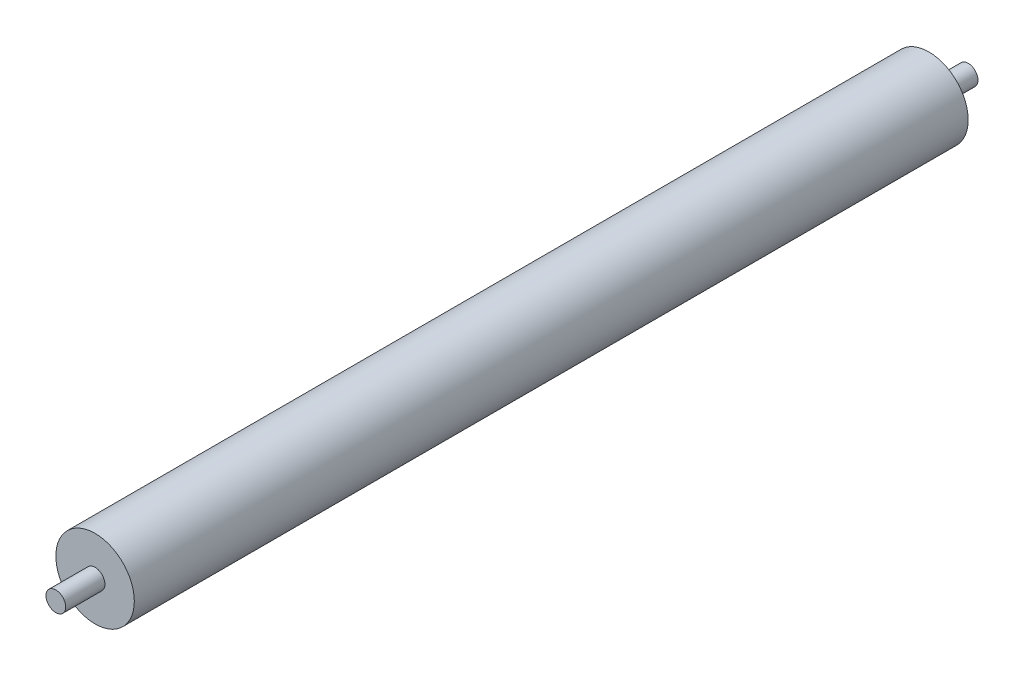
from build123d import *

# Parameters (mm, degrees)
SKETCH1_R           = 25.4
BOSS_EXTRUDE1_DEPTH = 590.55
SKETCH2_OUTSIDE_W   = 171.78
SKETCH2_OUTSIDE_H   = 171.78
SKETCH2_OUTSIDE_R   = 6.361935525
CUT_EXTRUDE1_DEPTH  = 25.4
SKETCH5_OUTSIDE_W   = 171.78
SKETCH5_OUTSIDE_H   = 171.78
SKETCH5_OUTSIDE_R   = 6.377907631
CUT_EXTRUDE4_DEPTH  = 25.4


with BuildPart() as part:
    # Sketch1 → Boss-Extrude1 (new body)
    with BuildSketch(Plane.XY):
        Circle(SKETCH1_R)
    extrude(amount=BOSS_EXTRUDE1_DEPTH)

    # Sketch2 outside → Cut-Extrude1 (cut)
    with BuildSketch(Plane.XY):
        Rectangle(SKETCH2_OUTSIDE_W, SKETCH2_OUTSIDE_H)
        Circle(SKETCH2_OUTSIDE_R, mode=Mode.SUBTRACT)
    extrude(amount=CUT_EXTRUDE1_DEPTH, mode=Mode.SUBTRACT)

    # Sketch5 outside → Cut-Extrude4 (cut)
    with BuildSketch(Plane.XY.offset(590.55)):
        Rectangle(SKETCH5_OUTSIDE_W, SKETCH5_OUTSIDE_H)
        Circle(SKETCH5_OUTSIDE_R, mode=Mode.SUBTRACT)
    extrude(amount=-CUT_EXTRUDE4_DEPTH, mode=Mode.SUBTRACT)


solid = part.part
